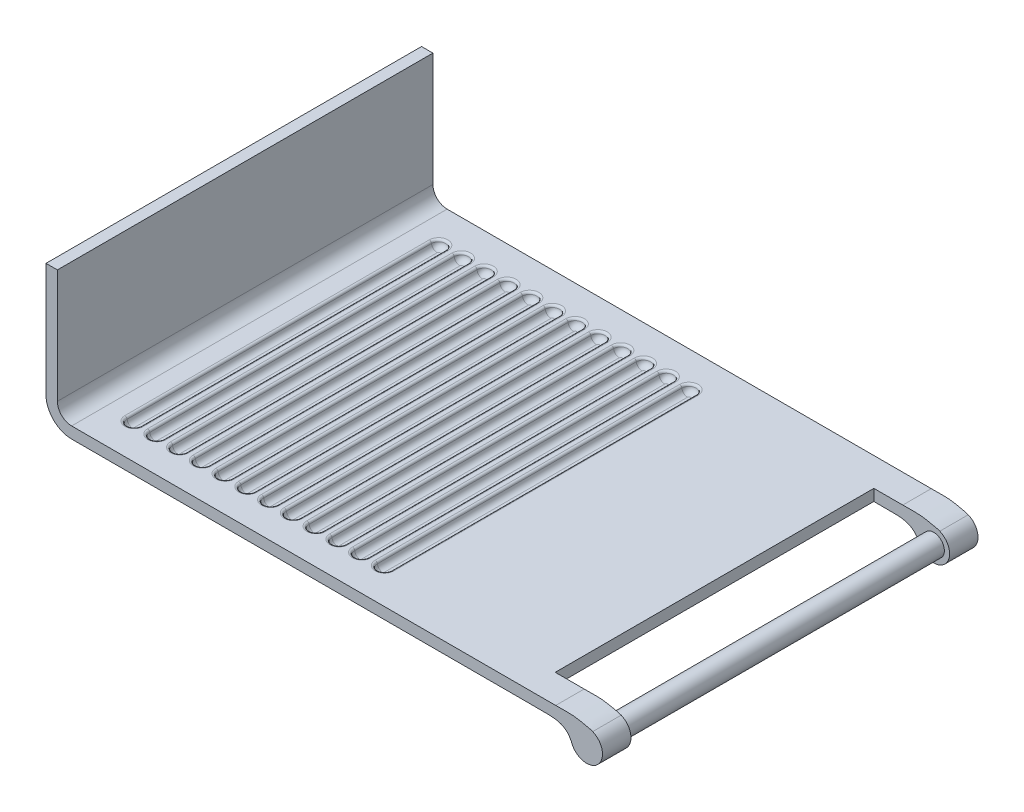
from build123d import *

# Parameters (mm, degrees)
TABLE_PROFILE_EXTRUDE_DEPTH = 83.82
DIVOT_CUT_DEPTH             = 1.5875
DIVOT_INNER_FILLET_R        = 1.27
DIVOT_OUTER_FILLET_R        = 0.508
DIVOT_START                 = 7.9375
DIVOT_PATTERN_DEPTH         = 67.945
DIVOT_PATTERN_2_ANGLE       = 180
DIVOT_PATTERN_3_ANGLE       = 180
DIVOT_PATTERN_4_ANGLE       = 180
DIVOT_PATTERN_5_ANGLE       = 180
DIVOT_PATTERN_6_ANGLE       = 180
DIVOT_PATTERN_7_ANGLE       = 180
DIVOT_PATTERN_8_ANGLE       = 180
DIVOT_PATTERN_9_ANGLE       = 180
DIVOT_PATTERN_10_ANGLE      = 180
DIVOT_PATTERN_11_ANGLE      = 180
DIVOT_PATTERN_12_ANGLE      = 180
DIVOT_PATTERN_13_ANGLE      = 180
DIVOT_PATTERN_14_ANGLE      = 180
DIVOT_PATTERN_15_ANGLE      = 180
DIVOT_PATTERN_16_ANGLE      = 180
DIVOT_PATTERN_17_ANGLE      = 180
DIVOT_PATTERN_18_ANGLE      = 180
DIVOT_PATTERN_19_ANGLE      = 180
DIVOT_PATTERN_20_ANGLE      = 180
DIVOT_PATTERN_21_ANGLE      = 180
DIVOT_PATTERN_22_ANGLE      = 180
DIVOT_PATTERN_23_ANGLE      = 180
HANDLE_ENDS_DEPTH           = 6.35
HANDLE_ROD_EXTRUDE_REACH    = 149.048
SKETCH10_R                  = 2.38125


with BuildPart() as part:
    # Table Profile → Table Profile Extrude (new body)
    with BuildSketch(Plane.XY):
        with BuildLine():
            Line((3.175, 0), (104.775, 0))
            Line((104.775, 0), (104.775, -2.54))
            Line((104.775, -2.54), (3.175, -2.54))
            ThreePointArc((3.175, -2.54), (-0.866115254, -0.866115254), (-2.54, 3.175))
            Line((-2.54, 3.175), (-2.54, 28.575))
            Line((-2.54, 28.575), (0, 28.575))
            Line((0, 28.575), (0, 3.175))
            ThreePointArc((0, 3.175), (0.92993597, 0.92993597), (3.175, 0))
        make_face()
    extrude(amount=TABLE_PROFILE_EXTRUDE_DEPTH)

    # Sketch3 → Divot Cut (cut)
    with BuildSketch(Plane(origin=(0, 0, 0), x_dir=(1, 0, 0), z_dir=(0, 1, 0))):
        with BuildLine():
            Line((63.5, -7.9375), (63.5, -75.8825))
            ThreePointArc((63.5, -75.8825), (65.0875, -77.47), (66.675, -75.8825))
            Line((66.675, -75.8825), (66.675, -7.9375))
            ThreePointArc((66.675, -7.9375), (65.0875, -6.35), (63.5, -7.9375))
        make_face()
    extrude(amount=-DIVOT_CUT_DEPTH, mode=Mode.SUBTRACT)

    # Divot Inner Fillet
    divot_inner_fillet_edges = [part.edges().sort_by_distance(p)[0] for p in [
        (65.0875, -1.5875, 6.35),
        (66.675, -1.5875, 41.91),
        (65.0875, -1.5875, 77.47),
        (63.5, -1.5875, 41.91),
    ]]
    fillet(divot_inner_fillet_edges, radius=DIVOT_INNER_FILLET_R)

    # Divot Outer Fillet
    divot_outer_fillet_edges = [part.edges().sort_by_distance(p)[0] for p in [
        (66.675, 0, 41.91),
        (65.0875, 0, 77.47),
        (63.5, 0, 41.91),
        (65.0875, 0, 6.35),
    ]]
    fillet(divot_outer_fillet_edges, radius=DIVOT_OUTER_FILLET_R)

    # Divot Pattern: read off the stored shape, not the designer's step
    # Divot Pattern outline → Divot Pattern (cut)
    with BuildSketch(Plane.XY.offset(DIVOT_START)):
        with BuildLine():
            ThreePointArc((58.427310582, -0.453571429), (58.841445557, -1.262410238), (59.69, -1.5875))
            Line((59.69, -1.5875), (60.325, -1.5875))
            ThreePointArc((60.325, -1.5875), (61.173554443, -1.262410238), (61.587689418, -0.453571429))
            ThreePointArc((61.587689418, -0.453571429), (61.753343408, -0.130035905), (62.092765185, 0))
            Line((62.092765185, 0), (57.922234815, 0))
            ThreePointArc((57.922234815, 0), (58.261656592, -0.130035905), (58.427310582, -0.453571429))
        make_face()
        with BuildLine():
            ThreePointArc((10.787689418, -0.453571429), (10.953343408, -0.130035905), (11.292765185, 0))
            Line((11.292765185, 0), (7.122234815, 0))
            ThreePointArc((7.122234815, 0), (7.461656592, -0.130035905), (7.627310582, -0.453571429))
            ThreePointArc((7.627310582, -0.453571429), (8.041445557, -1.262410238), (8.89, -1.5875))
            Line((8.89, -1.5875), (9.525, -1.5875))
            ThreePointArc((9.525, -1.5875), (10.373554443, -1.262410238), (10.787689418, -0.453571429))
        make_face()
        with BuildLine():
            ThreePointArc((15.867689418, -0.453571429), (16.033343408, -0.130035905), (16.372765185, 0))
            Line((16.372765185, 0), (12.202234815, 0))
            ThreePointArc((12.202234815, 0), (12.541656592, -0.130035905), (12.707310582, -0.453571429))
            ThreePointArc((12.707310582, -0.453571429), (13.121445557, -1.262410238), (13.97, -1.5875))
            Line((13.97, -1.5875), (14.605, -1.5875))
            ThreePointArc((14.605, -1.5875), (15.453554443, -1.262410238), (15.867689418, -0.453571429))
        make_face()
        with BuildLine():
            ThreePointArc((20.947689418, -0.453571429), (21.113343408, -0.130035905), (21.452765185, 0))
            Line((21.452765185, 0), (17.282234815, 0))
            ThreePointArc((17.282234815, 0), (17.621656592, -0.130035905), (17.787310582, -0.453571429))
            ThreePointArc((17.787310582, -0.453571429), (18.201445557, -1.262410238), (19.05, -1.5875))
            Line((19.05, -1.5875), (19.685, -1.5875))
            ThreePointArc((19.685, -1.5875), (20.533554443, -1.262410238), (20.947689418, -0.453571429))
        make_face()
        with BuildLine():
            ThreePointArc((26.027689418, -0.453571429), (26.193343408, -0.130035905), (26.532765185, 0))
            Line((26.532765185, 0), (22.362234815, 0))
            ThreePointArc((22.362234815, 0), (22.701656592, -0.130035905), (22.867310582, -0.453571429))
            ThreePointArc((22.867310582, -0.453571429), (23.281445557, -1.262410238), (24.13, -1.5875))
            Line((24.13, -1.5875), (24.765, -1.5875))
            ThreePointArc((24.765, -1.5875), (25.613554443, -1.262410238), (26.027689418, -0.453571429))
        make_face()
        with BuildLine():
            ThreePointArc((31.107689418, -0.453571429), (31.273343408, -0.130035905), (31.612765185, 0))
            Line((31.612765185, 0), (27.442234815, 0))
            ThreePointArc((27.442234815, 0), (27.781656592, -0.130035905), (27.947310582, -0.453571429))
            ThreePointArc((27.947310582, -0.453571429), (28.361445557, -1.262410238), (29.21, -1.5875))
            Line((29.21, -1.5875), (29.845, -1.5875))
            ThreePointArc((29.845, -1.5875), (30.693554443, -1.262410238), (31.107689418, -0.453571429))
        make_face()
        with BuildLine():
            ThreePointArc((36.187689418, -0.453571429), (36.353343408, -0.130035905), (36.692765185, 0))
            Line((36.692765185, 0), (32.522234815, 0))
            ThreePointArc((32.522234815, 0), (32.861656592, -0.130035905), (33.027310582, -0.453571429))
            ThreePointArc((33.027310582, -0.453571429), (33.441445557, -1.262410238), (34.29, -1.5875))
            Line((34.29, -1.5875), (34.925, -1.5875))
            ThreePointArc((34.925, -1.5875), (35.773554443, -1.262410238), (36.187689418, -0.453571429))
        make_face()
        with BuildLine():
            ThreePointArc((41.267689418, -0.453571429), (41.433343408, -0.130035905), (41.772765185, 0))
            Line((41.772765185, 0), (37.602234815, 0))
            ThreePointArc((37.602234815, 0), (37.941656592, -0.130035905), (38.107310582, -0.453571429))
            ThreePointArc((38.107310582, -0.453571429), (38.521445557, -1.262410238), (39.37, -1.5875))
            Line((39.37, -1.5875), (40.005, -1.5875))
            ThreePointArc((40.005, -1.5875), (40.853554443, -1.262410238), (41.267689418, -0.453571429))
        make_face()
        with BuildLine():
            ThreePointArc((46.347689418, -0.453571429), (46.513343408, -0.130035905), (46.852765185, 0))
            Line((46.852765185, 0), (42.682234815, 0))
            ThreePointArc((42.682234815, 0), (43.021656592, -0.130035905), (43.187310582, -0.453571429))
            ThreePointArc((43.187310582, -0.453571429), (43.601445557, -1.262410238), (44.45, -1.5875))
            Line((44.45, -1.5875), (45.085, -1.5875))
            ThreePointArc((45.085, -1.5875), (45.933554443, -1.262410238), (46.347689418, -0.453571429))
        make_face()
        with BuildLine():
            ThreePointArc((51.427689418, -0.453571429), (51.593343408, -0.130035905), (51.932765185, 0))
            Line((51.932765185, 0), (47.762234815, 0))
            ThreePointArc((47.762234815, 0), (48.101656592, -0.130035905), (48.267310582, -0.453571429))
            ThreePointArc((48.267310582, -0.453571429), (48.681445557, -1.262410238), (49.53, -1.5875))
            Line((49.53, -1.5875), (50.165, -1.5875))
            ThreePointArc((50.165, -1.5875), (51.013554443, -1.262410238), (51.427689418, -0.453571429))
        make_face()
        with BuildLine():
            ThreePointArc((56.507689418, -0.453571429), (56.673343408, -0.130035905), (57.012765185, 0))
            Line((57.012765185, 0), (52.842234815, 0))
            ThreePointArc((52.842234815, 0), (53.181656592, -0.130035905), (53.347310582, -0.453571429))
            ThreePointArc((53.347310582, -0.453571429), (53.761445557, -1.262410238), (54.61, -1.5875))
            Line((54.61, -1.5875), (55.245, -1.5875))
            ThreePointArc((55.245, -1.5875), (56.093554443, -1.262410238), (56.507689418, -0.453571429))
        make_face()
    extrude(amount=DIVOT_PATTERN_DEPTH, mode=Mode.SUBTRACT)

    # Divot Pattern 2 outline → Divot Pattern 2 (revolve, cut)
    with BuildSketch(Plane(origin=(60.0075, 0, 75.8825), x_dir=(-1, 0, 0), z_dir=(0, 0, -1))):
        with BuildLine():
            ThreePointArc((0.3175, -1.5875), (1.166054443, -1.262410238), (1.580189418, -0.453571429))
            ThreePointArc((1.580189418, -0.453571429), (1.745843408, -0.130035905), (2.085265185, 0))
            Line((2.085265185, 0), (0, 0))
            Line((0, 0), (0, -1.5875))
            Line((0, -1.5875), (0.3175, -1.5875))
        make_face()
    revolve(axis=Axis((60.0075, 0, 75.8825), (0, 1, 0)), revolution_arc=DIVOT_PATTERN_2_ANGLE, mode=Mode.SUBTRACT)

    # Divot Pattern 3 outline → Divot Pattern 3 (revolve, cut)
    with BuildSketch(Plane(origin=(60.0075, 0, 7.9375), x_dir=(1, 0, 0), z_dir=(0, 0, 1))):
        with BuildLine():
            ThreePointArc((0.3175, -1.5875), (1.166054443, -1.262410238), (1.580189418, -0.453571429))
            ThreePointArc((1.580189418, -0.453571429), (1.745843408, -0.130035905), (2.085265185, 0))
            Line((2.085265185, 0), (0, 0))
            Line((0, 0), (0, -1.5875))
            Line((0, -1.5875), (0.3175, -1.5875))
        make_face()
    revolve(axis=Axis((60.0075, 0, 7.9375), (0, 1, 0)), revolution_arc=DIVOT_PATTERN_3_ANGLE, mode=Mode.SUBTRACT)

    # Divot Pattern 4 outline → Divot Pattern 4 (revolve, cut)
    with BuildSketch(Plane(origin=(54.9275, 0, 75.8825), x_dir=(-1, 0, 0), z_dir=(0, 0, -1))):
        with BuildLine():
            ThreePointArc((0.3175, -1.5875), (1.166054443, -1.262410238), (1.580189418, -0.453571429))
            ThreePointArc((1.580189418, -0.453571429), (1.745843408, -0.130035905), (2.085265185, 0))
            Line((2.085265185, 0), (0, 0))
            Line((0, 0), (0, -1.5875))
            Line((0, -1.5875), (0.3175, -1.5875))
        make_face()
    revolve(axis=Axis((54.9275, 0, 75.8825), (0, 1, 0)), revolution_arc=DIVOT_PATTERN_4_ANGLE, mode=Mode.SUBTRACT)

    # Divot Pattern 5 outline → Divot Pattern 5 (revolve, cut)
    with BuildSketch(Plane(origin=(54.9275, 0, 7.9375), x_dir=(1, 0, 0), z_dir=(0, 0, 1))):
        with BuildLine():
            ThreePointArc((0.3175, -1.5875), (1.166054443, -1.262410238), (1.580189418, -0.453571429))
            ThreePointArc((1.580189418, -0.453571429), (1.745843408, -0.130035905), (2.085265185, 0))
            Line((2.085265185, 0), (0, 0))
            Line((0, 0), (0, -1.5875))
            Line((0, -1.5875), (0.3175, -1.5875))
        make_face()
    revolve(axis=Axis((54.9275, 0, 7.9375), (0, 1, 0)), revolution_arc=DIVOT_PATTERN_5_ANGLE, mode=Mode.SUBTRACT)

    # Divot Pattern 6 outline → Divot Pattern 6 (revolve, cut)
    with BuildSketch(Plane(origin=(49.8475, 0, 75.8825), x_dir=(-1, 0, 0), z_dir=(0, 0, -1))):
        with BuildLine():
            ThreePointArc((0.3175, -1.5875), (1.166054443, -1.262410238), (1.580189418, -0.453571429))
            ThreePointArc((1.580189418, -0.453571429), (1.745843408, -0.130035905), (2.085265185, 0))
            Line((2.085265185, 0), (0, 0))
            Line((0, 0), (0, -1.5875))
            Line((0, -1.5875), (0.3175, -1.5875))
        make_face()
    revolve(axis=Axis((49.8475, 0, 75.8825), (0, 1, 0)), revolution_arc=DIVOT_PATTERN_6_ANGLE, mode=Mode.SUBTRACT)

    # Divot Pattern 7 outline → Divot Pattern 7 (revolve, cut)
    with BuildSketch(Plane(origin=(49.8475, 0, 7.9375), x_dir=(1, 0, 0), z_dir=(0, 0, 1))):
        with BuildLine():
            ThreePointArc((0.3175, -1.5875), (1.166054443, -1.262410238), (1.580189418, -0.453571429))
            ThreePointArc((1.580189418, -0.453571429), (1.745843408, -0.130035905), (2.085265185, 0))
            Line((2.085265185, 0), (0, 0))
            Line((0, 0), (0, -1.5875))
            Line((0, -1.5875), (0.3175, -1.5875))
        make_face()
    revolve(axis=Axis((49.8475, 0, 7.9375), (0, 1, 0)), revolution_arc=DIVOT_PATTERN_7_ANGLE, mode=Mode.SUBTRACT)

    # Divot Pattern 8 outline → Divot Pattern 8 (revolve, cut)
    with BuildSketch(Plane(origin=(44.7675, 0, 75.8825), x_dir=(-1, 0, 0), z_dir=(0, 0, -1))):
        with BuildLine():
            ThreePointArc((0.3175, -1.5875), (1.166054443, -1.262410238), (1.580189418, -0.453571429))
            ThreePointArc((1.580189418, -0.453571429), (1.745843408, -0.130035905), (2.085265185, 0))
            Line((2.085265185, 0), (0, 0))
            Line((0, 0), (0, -1.5875))
            Line((0, -1.5875), (0.3175, -1.5875))
        make_face()
    revolve(axis=Axis((44.7675, 0, 75.8825), (0, 1, 0)), revolution_arc=DIVOT_PATTERN_8_ANGLE, mode=Mode.SUBTRACT)

    # Divot Pattern 9 outline → Divot Pattern 9 (revolve, cut)
    with BuildSketch(Plane(origin=(44.7675, 0, 7.9375), x_dir=(1, 0, 0), z_dir=(0, 0, 1))):
        with BuildLine():
            ThreePointArc((0.3175, -1.5875), (1.166054443, -1.262410238), (1.580189418, -0.453571429))
            ThreePointArc((1.580189418, -0.453571429), (1.745843408, -0.130035905), (2.085265185, 0))
            Line((2.085265185, 0), (0, 0))
            Line((0, 0), (0, -1.5875))
            Line((0, -1.5875), (0.3175, -1.5875))
        make_face()
    revolve(axis=Axis((44.7675, 0, 7.9375), (0, 1, 0)), revolution_arc=DIVOT_PATTERN_9_ANGLE, mode=Mode.SUBTRACT)

    # Divot Pattern 10 outline → Divot Pattern 10 (revolve, cut)
    with BuildSketch(Plane(origin=(39.6875, 0, 75.8825), x_dir=(-1, 0, 0), z_dir=(0, 0, -1))):
        with BuildLine():
            ThreePointArc((0.3175, -1.5875), (1.166054443, -1.262410238), (1.580189418, -0.453571429))
            ThreePointArc((1.580189418, -0.453571429), (1.745843408, -0.130035905), (2.085265185, 0))
            Line((2.085265185, 0), (0, 0))
            Line((0, 0), (0, -1.5875))
            Line((0, -1.5875), (0.3175, -1.5875))
        make_face()
    revolve(axis=Axis((39.6875, 0, 75.8825), (0, 1, 0)), revolution_arc=DIVOT_PATTERN_10_ANGLE, mode=Mode.SUBTRACT)

    # Divot Pattern 11 outline → Divot Pattern 11 (revolve, cut)
    with BuildSketch(Plane(origin=(39.6875, 0, 7.9375), x_dir=(1, 0, 0), z_dir=(0, 0, 1))):
        with BuildLine():
            ThreePointArc((0.3175, -1.5875), (1.166054443, -1.262410238), (1.580189418, -0.453571429))
            ThreePointArc((1.580189418, -0.453571429), (1.745843408, -0.130035905), (2.085265185, 0))
            Line((2.085265185, 0), (0, 0))
            Line((0, 0), (0, -1.5875))
            Line((0, -1.5875), (0.3175, -1.5875))
        make_face()
    revolve(axis=Axis((39.6875, 0, 7.9375), (0, 1, 0)), revolution_arc=DIVOT_PATTERN_11_ANGLE, mode=Mode.SUBTRACT)

    # Divot Pattern 12 outline → Divot Pattern 12 (revolve, cut)
    with BuildSketch(Plane(origin=(34.6075, 0, 75.8825), x_dir=(-1, 0, 0), z_dir=(0, 0, -1))):
        with BuildLine():
            ThreePointArc((0.3175, -1.5875), (1.166054443, -1.262410238), (1.580189418, -0.453571429))
            ThreePointArc((1.580189418, -0.453571429), (1.745843408, -0.130035905), (2.085265185, 0))
            Line((2.085265185, 0), (0, 0))
            Line((0, 0), (0, -1.5875))
            Line((0, -1.5875), (0.3175, -1.5875))
        make_face()
    revolve(axis=Axis((34.6075, 0, 75.8825), (0, 1, 0)), revolution_arc=DIVOT_PATTERN_12_ANGLE, mode=Mode.SUBTRACT)

    # Divot Pattern 13 outline → Divot Pattern 13 (revolve, cut)
    with BuildSketch(Plane(origin=(34.6075, 0, 7.9375), x_dir=(1, 0, 0), z_dir=(0, 0, 1))):
        with BuildLine():
            ThreePointArc((0.3175, -1.5875), (1.166054443, -1.262410238), (1.580189418, -0.453571429))
            ThreePointArc((1.580189418, -0.453571429), (1.745843408, -0.130035905), (2.085265185, 0))
            Line((2.085265185, 0), (0, 0))
            Line((0, 0), (0, -1.5875))
            Line((0, -1.5875), (0.3175, -1.5875))
        make_face()
    revolve(axis=Axis((34.6075, 0, 7.9375), (0, 1, 0)), revolution_arc=DIVOT_PATTERN_13_ANGLE, mode=Mode.SUBTRACT)

    # Divot Pattern 14 outline → Divot Pattern 14 (revolve, cut)
    with BuildSketch(Plane(origin=(29.5275, 0, 75.8825), x_dir=(-1, 0, 0), z_dir=(0, 0, -1))):
        with BuildLine():
            ThreePointArc((0.3175, -1.5875), (1.166054443, -1.262410238), (1.580189418, -0.453571429))
            ThreePointArc((1.580189418, -0.453571429), (1.745843408, -0.130035905), (2.085265185, 0))
            Line((2.085265185, 0), (0, 0))
            Line((0, 0), (0, -1.5875))
            Line((0, -1.5875), (0.3175, -1.5875))
        make_face()
    revolve(axis=Axis((29.5275, 0, 75.8825), (0, 1, 0)), revolution_arc=DIVOT_PATTERN_14_ANGLE, mode=Mode.SUBTRACT)

    # Divot Pattern 15 outline → Divot Pattern 15 (revolve, cut)
    with BuildSketch(Plane(origin=(29.5275, 0, 7.9375), x_dir=(1, 0, 0), z_dir=(0, 0, 1))):
        with BuildLine():
            ThreePointArc((0.3175, -1.5875), (1.166054443, -1.262410238), (1.580189418, -0.453571429))
            ThreePointArc((1.580189418, -0.453571429), (1.745843408, -0.130035905), (2.085265185, 0))
            Line((2.085265185, 0), (0, 0))
            Line((0, 0), (0, -1.5875))
            Line((0, -1.5875), (0.3175, -1.5875))
        make_face()
    revolve(axis=Axis((29.5275, 0, 7.9375), (0, 1, 0)), revolution_arc=DIVOT_PATTERN_15_ANGLE, mode=Mode.SUBTRACT)

    # Divot Pattern 16 outline → Divot Pattern 16 (revolve, cut)
    with BuildSketch(Plane(origin=(24.4475, 0, 75.8825), x_dir=(-1, 0, 0), z_dir=(0, 0, -1))):
        with BuildLine():
            ThreePointArc((0.3175, -1.5875), (1.166054443, -1.262410238), (1.580189418, -0.453571429))
            ThreePointArc((1.580189418, -0.453571429), (1.745843408, -0.130035905), (2.085265185, 0))
            Line((2.085265185, 0), (0, 0))
            Line((0, 0), (0, -1.5875))
            Line((0, -1.5875), (0.3175, -1.5875))
        make_face()
    revolve(axis=Axis((24.4475, 0, 75.8825), (0, 1, 0)), revolution_arc=DIVOT_PATTERN_16_ANGLE, mode=Mode.SUBTRACT)

    # Divot Pattern 17 outline → Divot Pattern 17 (revolve, cut)
    with BuildSketch(Plane(origin=(24.4475, 0, 7.9375), x_dir=(1, 0, 0), z_dir=(0, 0, 1))):
        with BuildLine():
            ThreePointArc((0.3175, -1.5875), (1.166054443, -1.262410238), (1.580189418, -0.453571429))
            ThreePointArc((1.580189418, -0.453571429), (1.745843408, -0.130035905), (2.085265185, 0))
            Line((2.085265185, 0), (0, 0))
            Line((0, 0), (0, -1.5875))
            Line((0, -1.5875), (0.3175, -1.5875))
        make_face()
    revolve(axis=Axis((24.4475, 0, 7.9375), (0, 1, 0)), revolution_arc=DIVOT_PATTERN_17_ANGLE, mode=Mode.SUBTRACT)

    # Divot Pattern 18 outline → Divot Pattern 18 (revolve, cut)
    with BuildSketch(Plane(origin=(19.3675, 0, 75.8825), x_dir=(-1, 0, 0), z_dir=(0, 0, -1))):
        with BuildLine():
            ThreePointArc((0.3175, -1.5875), (1.166054443, -1.262410238), (1.580189418, -0.453571429))
            ThreePointArc((1.580189418, -0.453571429), (1.745843408, -0.130035905), (2.085265185, 0))
            Line((2.085265185, 0), (0, 0))
            Line((0, 0), (0, -1.5875))
            Line((0, -1.5875), (0.3175, -1.5875))
        make_face()
    revolve(axis=Axis((19.3675, 0, 75.8825), (0, 1, 0)), revolution_arc=DIVOT_PATTERN_18_ANGLE, mode=Mode.SUBTRACT)

    # Divot Pattern 19 outline → Divot Pattern 19 (revolve, cut)
    with BuildSketch(Plane(origin=(19.3675, 0, 7.9375), x_dir=(1, 0, 0), z_dir=(0, 0, 1))):
        with BuildLine():
            ThreePointArc((0.3175, -1.5875), (1.166054443, -1.262410238), (1.580189418, -0.453571429))
            ThreePointArc((1.580189418, -0.453571429), (1.745843408, -0.130035905), (2.085265185, 0))
            Line((2.085265185, 0), (0, 0))
            Line((0, 0), (0, -1.5875))
            Line((0, -1.5875), (0.3175, -1.5875))
        make_face()
    revolve(axis=Axis((19.3675, 0, 7.9375), (0, 1, 0)), revolution_arc=DIVOT_PATTERN_19_ANGLE, mode=Mode.SUBTRACT)

    # Divot Pattern 20 outline → Divot Pattern 20 (revolve, cut)
    with BuildSketch(Plane(origin=(14.2875, 0, 75.8825), x_dir=(-1, 0, 0), z_dir=(0, 0, -1))):
        with BuildLine():
            ThreePointArc((0.3175, -1.5875), (1.166054443, -1.262410238), (1.580189418, -0.453571429))
            ThreePointArc((1.580189418, -0.453571429), (1.745843408, -0.130035905), (2.085265185, 0))
            Line((2.085265185, 0), (0, 0))
            Line((0, 0), (0, -1.5875))
            Line((0, -1.5875), (0.3175, -1.5875))
        make_face()
    revolve(axis=Axis((14.2875, 0, 75.8825), (0, 1, 0)), revolution_arc=DIVOT_PATTERN_20_ANGLE, mode=Mode.SUBTRACT)

    # Divot Pattern 21 outline → Divot Pattern 21 (revolve, cut)
    with BuildSketch(Plane(origin=(14.2875, 0, 7.9375), x_dir=(1, 0, 0), z_dir=(0, 0, 1))):
        with BuildLine():
            ThreePointArc((0.3175, -1.5875), (1.166054443, -1.262410238), (1.580189418, -0.453571429))
            ThreePointArc((1.580189418, -0.453571429), (1.745843408, -0.130035905), (2.085265185, 0))
            Line((2.085265185, 0), (0, 0))
            Line((0, 0), (0, -1.5875))
            Line((0, -1.5875), (0.3175, -1.5875))
        make_face()
    revolve(axis=Axis((14.2875, 0, 7.9375), (0, 1, 0)), revolution_arc=DIVOT_PATTERN_21_ANGLE, mode=Mode.SUBTRACT)

    # Divot Pattern 22 outline → Divot Pattern 22 (revolve, cut)
    with BuildSketch(Plane(origin=(9.2075, 0, 75.8825), x_dir=(-1, 0, 0), z_dir=(0, 0, -1))):
        with BuildLine():
            ThreePointArc((0.3175, -1.5875), (1.166054443, -1.262410238), (1.580189418, -0.453571429))
            ThreePointArc((1.580189418, -0.453571429), (1.745843408, -0.130035905), (2.085265185, 0))
            Line((2.085265185, 0), (0, 0))
            Line((0, 0), (0, -1.5875))
            Line((0, -1.5875), (0.3175, -1.5875))
        make_face()
    revolve(axis=Axis((9.2075, 0, 75.8825), (0, 1, 0)), revolution_arc=DIVOT_PATTERN_22_ANGLE, mode=Mode.SUBTRACT)

    # Divot Pattern 23 outline → Divot Pattern 23 (revolve, cut)
    with BuildSketch(Plane(origin=(9.2075, 0, 7.9375), x_dir=(1, 0, 0), z_dir=(0, 0, 1))):
        with BuildLine():
            ThreePointArc((0.3175, -1.5875), (1.166054443, -1.262410238), (1.580189418, -0.453571429))
            ThreePointArc((1.580189418, -0.453571429), (1.745843408, -0.130035905), (2.085265185, 0))
            Line((2.085265185, 0), (0, 0))
            Line((0, 0), (0, -1.5875))
            Line((0, -1.5875), (0.3175, -1.5875))
        make_face()
    revolve(axis=Axis((9.2075, 0, 7.9375), (0, 1, 0)), revolution_arc=DIVOT_PATTERN_23_ANGLE, mode=Mode.SUBTRACT)

    # Sketch7 → Handle Ends (add)
    with BuildSketch(Plane.XY.offset(83.82)):
        with BuildLine():
            Line((104.775, 0), (111.231603375, 0))
            add(Edge.make_bspline(
                [(111.231603375, 0), (112.987562918, 0), (115.020478281, 0.084261879), (116.770232072, -0.26326082), (118.971618736, -0.706620495), (119.494124948, -0.924406055)],
                knots=[0, 0, 0, 0, 0.370197465, 0.782347025, 1, 1, 1, 1], degree=3))
            ThreePointArc((119.494124948, -0.924406055), (120.539367145, -6.798089317), (114.762791963, -5.306826273))
            add(Edge.make_bspline(
                [(104.775, -2.54), (105.886022414, -2.54), (109.704181228, -2.582369343), (113.495256207, -2.503091228), (114.762791963, -5.306826273)],
                knots=[0, 0, 0, 0, 0.334801408, 1, 1, 1, 1], degree=3))
            Line((104.775, -2.54), (104.775, 0))
        make_face()
    handle_ends = extrude(amount=-HANDLE_ENDS_DEPTH)

    # Handle Mirror: Handle Ends across plane
    add(handle_ends.mirror(Plane.XY.offset(41.91)))

    # Sketch10 → Handle Rod Extrude (add, up to next)
    with BuildSketch(Plane(origin=(0, 0, 77.47), x_dir=(-1, 0, 0), z_dir=(0, 0, -1)), mode=Mode.PRIVATE) as handle_rod_extrude_sk1:
        with Locations(Location((-118.130082505, -4.196985971, 0), (0, 0, 180))):
            Circle(SKETCH10_R)
    handle_rod_extrude_tool1 = extrude(handle_rod_extrude_sk1.sketch, amount=HANDLE_ROD_EXTRUDE_REACH, mode=Mode.PRIVATE) - part.part
    add(handle_rod_extrude_tool1.solids().sort_by_distance((118.130083, -4.196986, 77.47))[0])


solid = part.part
